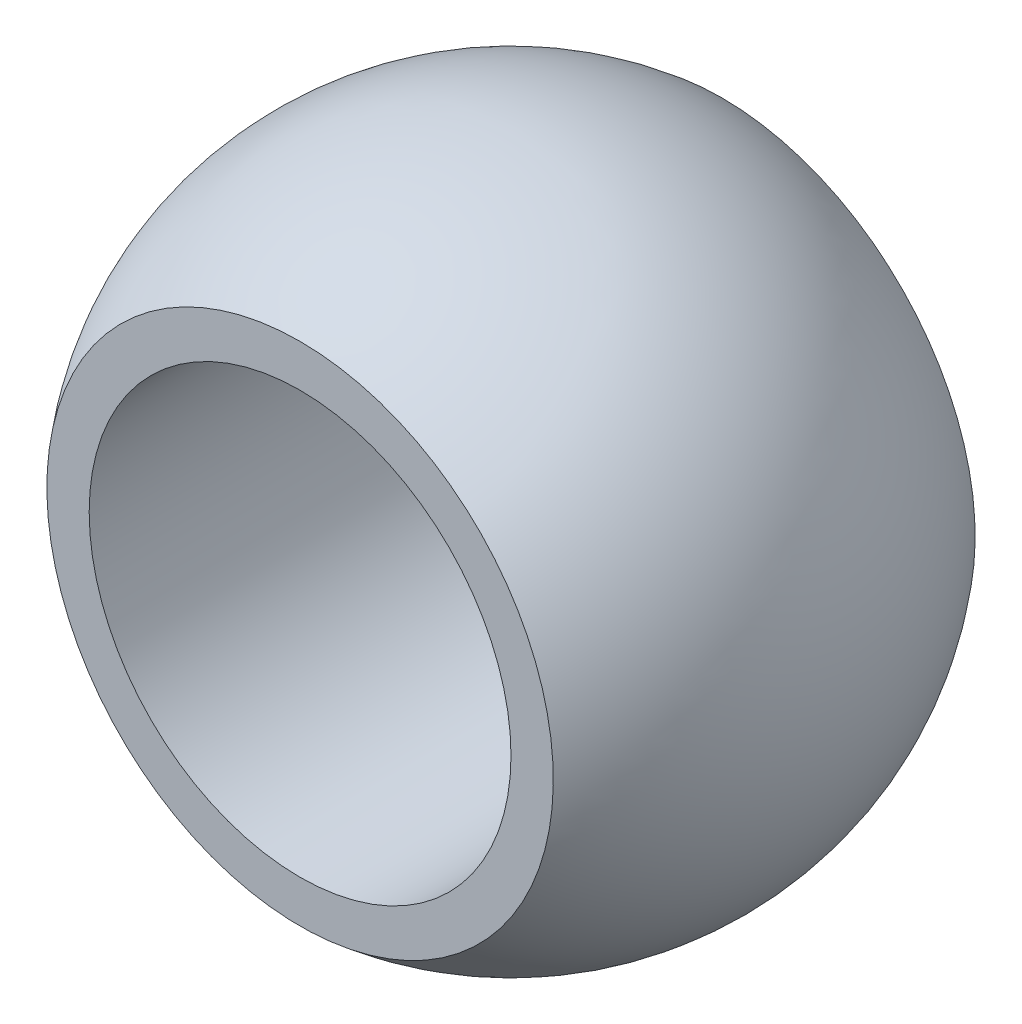
from build123d import *


with BuildPart() as part:
    # Sketch2 → Revolve1 (revolve)
    with BuildSketch(Plane(origin=(0, 0, 0), x_dir=(0, 0, -1), z_dir=(1, 0, 0))):
        with BuildLine():
            Line((-4, 4), (4, 4))
            Line((4, 4), (4, 4.802343178))
            ThreePointArc((4, 4.802343178), (0, 6.25), (-4, 4.802343178))
            Line((-4, 4.802343178), (-4, 4))
        make_face()
    revolve(axis=Axis((0, 0, 4), (0, 0, -1)))


solid = part.part
